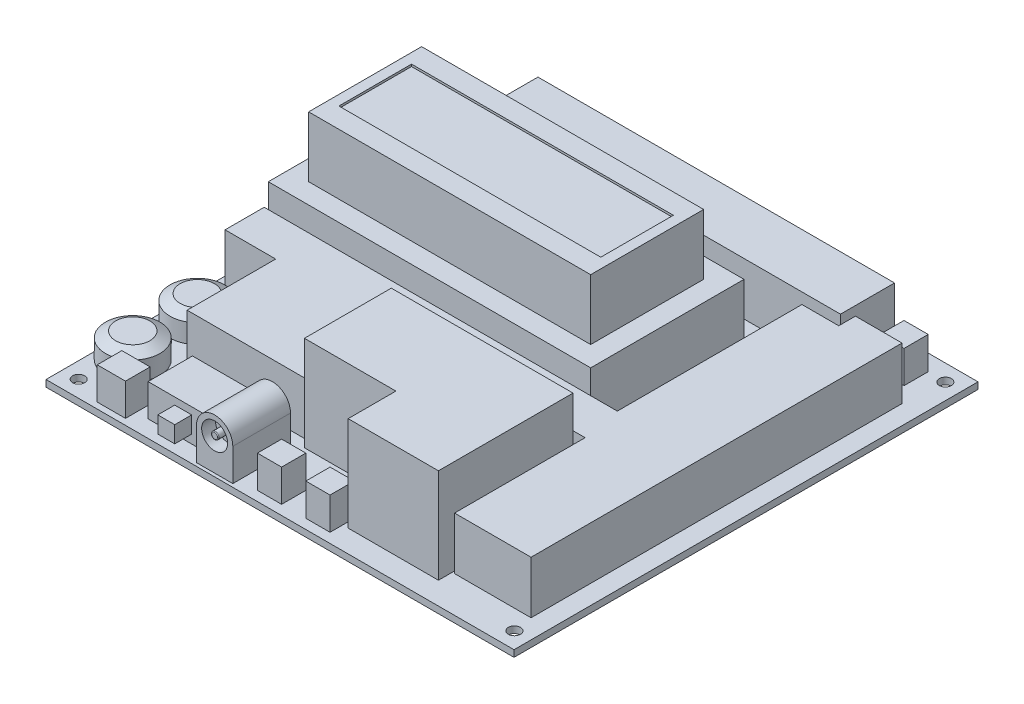
from build123d import *
from OCP.BRepFilletAPI import BRepFilletAPI_MakeChamfer

# Parameters (mm, degrees)
SKETCH1_W              = 116
SKETCH1_H              = 115
SKETCH1_R              = 1.5
BASE_FLANGE1_DEPTH     = 1.65
SKETCH3_W              = 79.9
SKETCH3_H              = 38
EXTRUDE1_DEPTH         = 15
SKETCH4_W              = 69.9
SKETCH4_H              = 28
EXTRUDE2_DEPTH         = 15
SKETCH6_W              = 64.9
SKETCH6_H              = 18
DISPLAY_DEPTH          = 0.53
SKETCH7_W              = 91
SKETCH7_H              = 60
WIRING_BOARD_DEPTH     = 15
SKETCH8_W              = 7
SKETCH8_H              = 20
EXTRUDE5_DEPTH         = 7.5
SKETCH9_W              = 10.5
SKETCH9_H              = 8.5
SKETCH9_W_2            = 5.5
SKETCH9_H_2            = 3.5
USB_DEPTH              = 7.5
CHAMFER1_SIZE          = 2
SKETCH10_R             = 6.75
POTENTIOMETERS_DEPTH   = 6.2
SKETCH11_W             = 7
SKETCH11_H             = 6.1
SKETCH11_W_2           = 9
SKETCH11_H_2           = 14.3
SKETCH11_W_3           = 6
SKETCH11_H_3           = 6
SKETCH11_W_4           = 2
SKETCH11_H_4           = 5
KEEP_ACCESSIBLE_DEPTH  = 8
EXTRUDE9_DEPTH         = 13
HOT_VOLTAGE_REGS_DEPTH = 23.5
SKETCH14_R             = 4.5
EXTRUDE10_DEPTH        = 14.3
EXTRUDE11_DEPTH        = 10
EXTRUDE11_DEPTH_BACK   = 3.4
SKETCH15_R             = 3.219788924
SKETCH15_R_2           = 0.896300673
SKETCH15_W             = 5.949829442
SKETCH15_H             = 2.638553101
SKETCH15_H_2           = 2.133019186
FILLET1_R              = 0.2
CHAMFER2_SIZE          = 1.5
CHAMFER2_SIZE2         = 2.5


# Sheet-metal steps are written as plain solids
with BuildPart() as part:
    # Sketch1 → Base-Flange1 (new body)
    with BuildSketch(Plane(origin=(0, 0, 0), x_dir=(1, 0, 0), z_dir=(0, 1, 0))):
        Rectangle(SKETCH1_W, SKETCH1_H)
        with Locations(Location((54, 53.4, 0), (0, 0, 270))):
            Circle(SKETCH1_R, mode=Mode.SUBTRACT)
        with Locations(Location((54, -53.4, 0), (0, 0, 90))):
            Circle(SKETCH1_R, mode=Mode.SUBTRACT)
        with Locations(Location((-54, 53.4, 0), (0, 0, 90))):
            Circle(SKETCH1_R, mode=Mode.SUBTRACT)
        with Locations(Location((-54, -53.4, 0), (0, 0, 270))):
            Circle(SKETCH1_R, mode=Mode.SUBTRACT)
    extrude(amount=BASE_FLANGE1_DEPTH)

    # Sketch3 → Extrude1 (add)
    with BuildSketch(Plane(origin=(0, 1.65, 0), x_dir=(1, 0, 0), z_dir=(0, 1, 0))):
        with Locations((-17.95, 16.5)):
            Rectangle(SKETCH3_W, SKETCH3_H)
    extrude(amount=EXTRUDE1_DEPTH)

    # Sketch4 → Extrude2 (add)
    with BuildSketch(Plane(origin=(0, 16.65, 0), x_dir=(1, 0, 0), z_dir=(0, 1, 0))):
        with Locations((-17.95, 16.5)):
            Rectangle(SKETCH4_W, SKETCH4_H)
    extrude(amount=EXTRUDE2_DEPTH)

    # Sketch6 → Display! (cut)
    with BuildSketch(Plane(origin=(0, 31.65, 0), x_dir=(1, 0, 0), z_dir=(0, 1, 0))):
        with Locations((-17.95, 16.5)):
            Rectangle(SKETCH6_W, SKETCH6_H)
    extrude(amount=-DISPLAY_DEPTH, mode=Mode.SUBTRACT)

    # Sketch7 → Wiring Board (add)
    with BuildSketch(Plane.XZ):
        with Locations((-12.4, -9.5)):
            Rectangle(SKETCH7_W, SKETCH7_H)
    extrude(amount=WIRING_BOARD_DEPTH)

    # Sketch8 → Extrude5 (add)
    with BuildSketch(Plane.XZ.offset(15)):
        with Locations((-40.4, -0.8)):
            Rectangle(SKETCH8_W, SKETCH8_H)
    extrude(amount=EXTRUDE5_DEPTH)

    # Sketch9 → USB (cut)
    with BuildSketch(Plane.ZY.offset(58)):
        with Locations((-24.25, -7.35)):
            Rectangle(SKETCH9_W, SKETCH9_H)
        with Locations((-24.25, -7.35)):
            Rectangle(SKETCH9_W_2, SKETCH9_H_2, mode=Mode.SUBTRACT)
    extrude(amount=-USB_DEPTH, mode=Mode.SUBTRACT)

    # Chamfer1
    chamfer1_edges = [part.edges().sort_by_distance(p)[0] for p in [
        (-54.2, -3.1, -19),
        (-54.2, -3.1, -29.5),
    ]]
    chamfer(chamfer1_edges, length=CHAMFER1_SIZE)

    # Sketch10 → Potentiometers (add)
    with BuildSketch(Plane(origin=(0, 1.65, 0), x_dir=(1, 0, 0), z_dir=(0, 1, 0))):
        with Locations(Location((-51.5, -26.5, 0), (0, 0, 164.357528987))):
            Circle(SKETCH10_R)
        with Locations(Location((-51.5, -42.5, 0), (0, 0, 164.357528987))):
            Circle(SKETCH10_R)
    extrude(amount=POTENTIOMETERS_DEPTH)

    # Sketch11 → Keep Accessible!! (add)
    with BuildSketch(Plane(origin=(0, 1.65, 0), x_dir=(1, 0, 0), z_dir=(0, 1, 0))):
        Polygon((-26.092034571, -53.3), (-23.1, -53.3), (-23.1, -42.3), (-36.9, -42.3), (-36.9, -53.3), (-30.292034571, -53.3), (-30.292034571, -57.5), (-26.092034571, -57.5), align=None)
        with Locations((-43.3, -52.95)):
            Rectangle(SKETCH11_W, SKETCH11_H)
        with Locations((-17, -49.55)):
            Rectangle(SKETCH11_W_2, SKETCH11_H_2)
        with Locations((-5, -52.1)):
            Rectangle(SKETCH11_W_3, SKETCH11_H_3)
        with Locations((7, -52.1)):
            Rectangle(SKETCH11_W_3, SKETCH11_H_3)
        with Locations((46.66, 50.5)):
            Rectangle(SKETCH11_W_3, SKETCH11_H_3)
        with Locations((-54.82, 45.3)):
            Rectangle(SKETCH11_W_4, SKETCH11_H_4)
        with Locations((-52.52, 45.3)):
            Rectangle(SKETCH11_W_4, SKETCH11_H_4)
    extrude(amount=KEEP_ACCESSIBLE_DEPTH)

    # Sketch12 → Extrude9 (add)
    with BuildSketch(Plane(origin=(0, 1.65, 0), x_dir=(1, 0, 0), z_dir=(0, 1, 0))):
        Polygon((-48.948570669, 53.670290093), (-48.948570669, 44.832154672), (-35.833918109, 44.832154672), (-35.833918109, 41.981143246), (37.294524965, 41.981143246), (39.432783534, 41.981143246), (39.432783534, 53.670290093), (39.432783534, 55.380896948), (-48.948570669, 55.380896948), align=None)
        Polygon((41.713592675, 43.406648959), (41.713592675, 39.272682392), (32.590356112, 39.272682392), (32.590356112, -6.486050994), (-54.935694663, -6.486050994), (-54.935694663, -16.179489842), (-42.391244389, -16.179489842), (-42.391244389, -38.132277821), (-13.310927845, -38.132277821), (-13.310927845, -16.179489842), (34.300962968, -16.179489842), (34.300962968, -48.538469526), (53.26018895, -48.538469526), (53.26018895, 43.406648959), align=None)
    extrude(amount=EXTRUDE9_DEPTH)

    # Sketch13 → Hot! Voltage Regs (add)
    with BuildSketch(Plane(origin=(0, 1.65, 0), x_dir=(1, 0, 0), z_dir=(0, 1, 0))):
        Polygon((-11.315219847, -18.602849554), (-11.315219847, -40.12798582), (11.350320989, -40.12798582), (11.350320989, -51.959683237), (33.730760683, -51.959683237), (33.730760683, -18.602849554), align=None)
    extrude(amount=HOT_VOLTAGE_REGS_DEPTH)

    # Sketch14 → Extrude10 (add)
    with BuildSketch(Plane.XY.offset(56.7)):
        with Locations((-17, 9.65)):
            Circle(SKETCH14_R)
    extrude(amount=-EXTRUDE10_DEPTH)

    # Sketch15 → Extrude11 (cut, two sides: drawn at the far end of the back side and taken through both)
    # profile 1 of 3: a face of its own
    with BuildSketch(Plane.XY.offset(56.7).offset(-EXTRUDE11_DEPTH_BACK)):
        with Locations(Location((-17, 9.65, 0), (0, 0, 180))):
            Circle(SKETCH15_R)
        with Locations(Location((-17, 9.65, 0), (0, 0, 180))):
            Circle(SKETCH15_R_2, mode=Mode.SUBTRACT)
    # profile 2 of 3: a face of its own
    with BuildSketch(Plane.XY.offset(56.7).offset(-EXTRUDE11_DEPTH_BACK)):
        with Locations((-28.188847243, 9.227024123)):
            Rectangle(SKETCH15_W, SKETCH15_H)
    # profile 3 of 3: a face of its own
    with BuildSketch(Plane.XY.offset(56.7).offset(-EXTRUDE11_DEPTH_BACK)):
        with Locations((-28.188847243, 2.716509593)):
            Rectangle(SKETCH15_W, SKETCH15_H_2)
    extrude(amount=EXTRUDE11_DEPTH + EXTRUDE11_DEPTH_BACK, mode=Mode.SUBTRACT)

    # Fillet1
    fillet1_edges = [part.edges().sort_by_distance(p)[0] for p in [
        (-16.103699327, 9.65, 56.7),
        (-57.9, -9.1, -24.25),
        (-57.9, -7.35, -21.5),
        (-57.9, -5.6, -24.25),
        (-57.9, -7.35, -27),
    ]]
    fillet(fillet1_edges, radius=FILLET1_R)

    # Chamfer2: one chamfer whose edges measure the first distance from different faces: ONE call of the kernel's chamfer builder (chamfer() names one face for all edges)
    chamfer2_edges_1 = [part.edges().sort_by_distance(p)[0] for p in [
        (-45, 7.85, 28.320027472),
    ]]
    chamfer2_side_1 = [part.faces().sort_by_distance(p)[0] for p in [
        (-45, 4.75, 28.320027472),
    ]]
    chamfer2_edges_2 = [part.edges().sort_by_distance(p)[0] for p in [
        (-45, 7.85, 44.320027472),
    ]]
    chamfer2_side_2 = [part.faces().sort_by_distance(p)[0] for p in [
        (-45, 4.75, 44.320027472),
    ]]
    chamfer2 = BRepFilletAPI_MakeChamfer(part.part.solid().wrapped)
    for e in chamfer2_edges_1:
        chamfer2.Add(CHAMFER2_SIZE, CHAMFER2_SIZE2, e.wrapped, chamfer2_side_1[0].wrapped)  # the first distance lies on this face
    for e in chamfer2_edges_2:
        chamfer2.Add(CHAMFER2_SIZE, CHAMFER2_SIZE2, e.wrapped, chamfer2_side_2[0].wrapped)  # the first distance lies on this face
    add(Compound.cast(chamfer2.Shape()), mode=Mode.REPLACE)


solid = part.part
